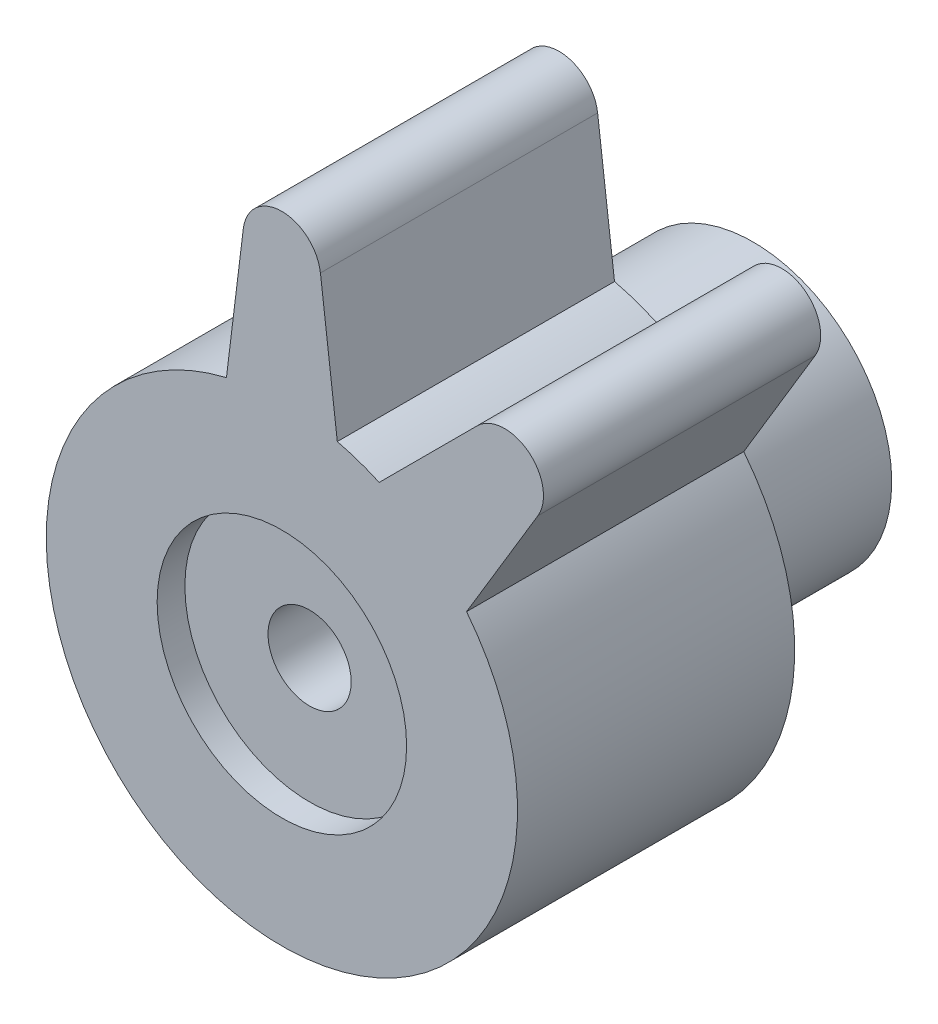
from build123d import *

# Parameters (mm, degrees)
SKETCH1_R           = 1.5
BOSS_EXTRUDE1_DEPTH = 10
SKETCH5_R           = 5
BOSS_EXTRUDE3_DEPTH = 7
SKETCH8_R           = 4.5
CUT_EXTRUDE2_DEPTH  = 1


with BuildPart() as part:
    # Sketch1 → Boss-Extrude1 (new body)
    with BuildSketch(Plane.XY):
        with BuildLine():
            Line((-1.390653283, 13.224086579), (-2, 8.261355821))
            ThreePointArc((-2, 8.261355821), (-2.767329313, -8.036907893), (6.66222002, 5.278714276))
            Line((6.66222002, 5.278714276), (9.237410395, 9.564550779))
            ThreePointArc((9.237410395, 9.564550779), (8.899037344, 11.390248383), (7.045710912, 11.276894083))
            Line((7.045710912, 11.276894083), (3.510177006, 7.741360177))
            ThreePointArc((3.510177006, 7.741360177), (2.767329313, 8.036907893), (2, 8.261355821))
            Line((2, 8.261355821), (1.390653283, 13.224086579))
            ThreePointArc((1.390653283, 13.224086579), (0, 14.454432673), (-1.390653283, 13.224086579))
        make_face()
        Circle(SKETCH1_R, mode=Mode.SUBTRACT)
    extrude(amount=BOSS_EXTRUDE1_DEPTH)

    # Sketch5 → Boss-Extrude3 (add)
    with BuildSketch(Plane(origin=(0, 0, 0), x_dir=(-1, 0, 0), z_dir=(0, 0, -1))):
        Circle(SKETCH5_R)
        with BuildLine():
            Line((1.95, -2.6), (-1.95, -2.6))
            ThreePointArc((-1.95, -2.6), (0, 3.25), (1.95, -2.6))
        make_face(mode=Mode.SUBTRACT)
    extrude(amount=BOSS_EXTRUDE3_DEPTH)

    # Sketch8 → Cut-Extrude2 (cut)
    with BuildSketch(Plane.XY.offset(10)):
        Circle(SKETCH8_R)
    extrude(amount=-CUT_EXTRUDE2_DEPTH, mode=Mode.SUBTRACT)


solid = part.part
